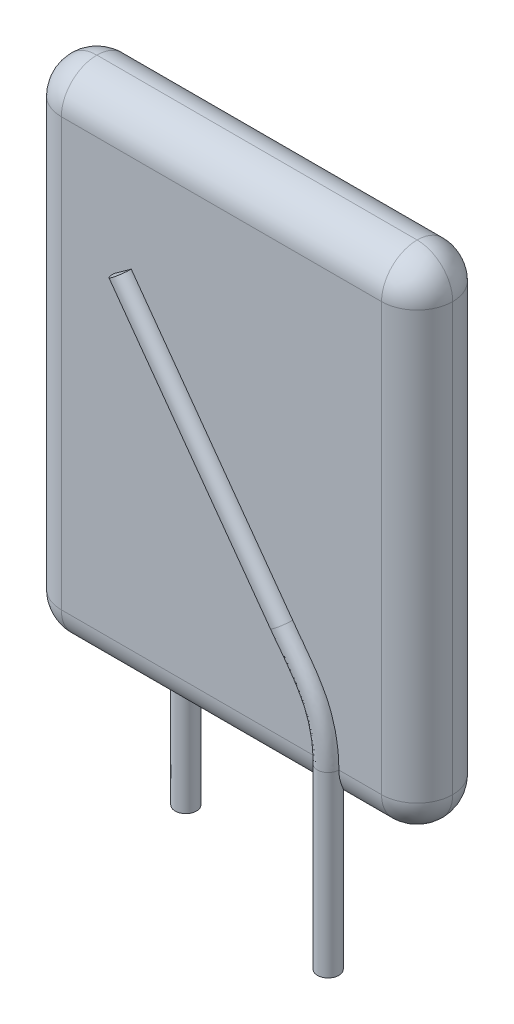
from build123d import *

# Parameters (mm, degrees)
SKETCH_1_W               = 11
SKETCH_1_H               = 14
EXTRUDE_1_DEPTH          = 1
FILLET_1_R               = 1
SWEEP_1_PROFILE_R        = 0.3
PATTERN_CIRCULAR_1_COUNT = 2


with BuildPart() as part:
    # 草图1 → 凸台-拉伸1 (new, symmetric)
    with BuildSketch(Plane.XY):
        with Locations((0, 7)):
            Rectangle(SKETCH_1_W, SKETCH_1_H)
    extrude(amount=EXTRUDE_1_DEPTH, both=True)

    # 圆角1
    fillet_1_edges = [part.edges().sort_by_distance(p)[0] for p in [
        (5.5, 7, 1),
        (0, 14, 1),
        (-5.5, 7, 1),
        (0, 14, -1),
        (5.5, 7, -1),
        (0, 0, -1),
        (-5.5, 7, -1),
        (0, 0, 1),
        (-5.5, 14, 0),
        (5.5, 14, 0),
        (5.5, 0, 0),
        (-5.5, 0, 0),
    ]]
    fillet(fillet_1_edges, radius=FILLET_1_R - 0.0001)  # a hair under: the kernel refuses the full size


with BuildPart() as body_2:
    # 扫描1: sweep along a path in 草图2
    with BuildLine() as sweep_1_path:  # in the path sketch's own coordinates; laid on its plane below (add() does not lay a ready-made edge on the line's plane)
        Line((-2.777076375, 10.098416615), (1.760468209, 3.822595636))
        add(Edge.make_bspline(
            [(1.760468209, 3.822595636), (2.101083655, 3.351494687), (2.752798271, 2.574753157), (3, 1.604059465), (3, 1)],
            knots=[0, 0, 0, 0, 0.503139712, 1, 1, 1, 1], degree=3))
        Line((3, 1), (3, -4))
    # 扫描1 profile (on start of the path) → 扫描1 (sweep)
    with BuildSketch(Plane(origin=(-2.777076375, 10.098416615, 1), x_dir=(-0.8103722298473264, -0.5859153941417414, 0), z_dir=(0.5859153941417414, -0.8103722298473264, 0))):
        Circle(SWEEP_1_PROFILE_R)
    sweep(path=Plane.XY.offset(1) * sweep_1_path.line)


with BuildPart() as pattern_circular_1_1:
    # 阵列(圆周)1: pattern copy
    add(body_2.part.rotate(Axis((0, 14.9, 0), (0, -1, 0)), 1 * 360 / PATTERN_CIRCULAR_1_COUNT))


solid = Compound([part.part, body_2.part, pattern_circular_1_1.part])
